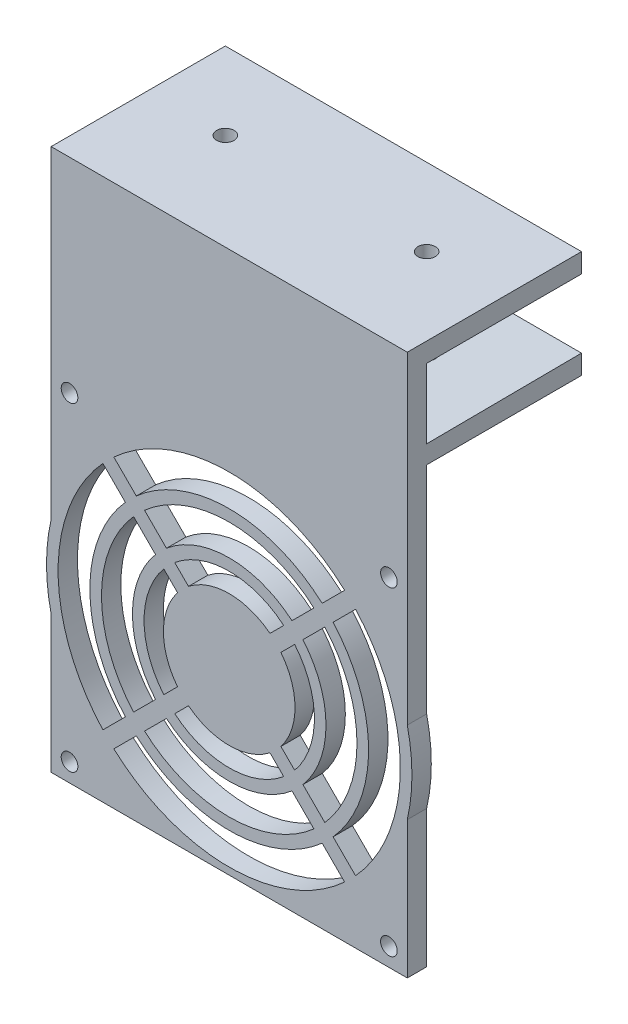
from build123d import *

# Parameters (mm, degrees)
SKETCH1_W            = 92
SKETCH1_H            = 140
BOSS_EXTRUDE1_DEPTH  = 5
SKETCH3_W            = 40
SKETCH3_H            = 5
BOSS_EXTRUDE2_DEPTH  = 92
M4_CLEARANCE_HOLE1_D = 4.5
SKETCH7_R            = 2.15
CUT_EXTRUDE2_DEPTH   = 96.084173236
BOSS_EXTRUDE3_DEPTH  = 5


with BuildPart() as part:
    # Sketch1 → Boss-Extrude1 (new body)
    with BuildSketch(Plane.XY):
        Rectangle(SKETCH1_W, SKETCH1_H)
    extrude(amount=BOSS_EXTRUDE1_DEPTH)

    # Sketch3 → Boss-Extrude2 (add)
    with BuildSketch(Plane(origin=(46, 0, 0), x_dir=(0, 0, -1), z_dir=(1, 0, 0))):
        with Locations((20, 67.5)):
            Rectangle(SKETCH3_W, SKETCH3_H)
        Polygon((0, 47), (40, 47.3), (40, 42.3), (0, 42.3), align=None)
    extrude(amount=-BOSS_EXTRUDE2_DEPTH)

    # M4 Clearance Hole1 (through all)
    with Locations(Plane(origin=(0, 70, 0), x_dir=(1, 0, 0), z_dir=(0, 1, 0))):
        with Locations((-26, 20), (26, 20)):
            Hole(M4_CLEARANCE_HOLE1_D / 2)

    # Sketch7 → Cut-Extrude2 (cut, through all)
    with BuildSketch(Plane.XY.offset(5)):
        with BuildLine():
            ThreePointArc((13.351549949, -13.476877176), (17, -24), (13.351549949, -34.523122824))
            Line((13.351549949, -34.523122824), (16.906146947, -38.077719822))
            ThreePointArc((16.906146947, -38.077719822), (22, -24), (16.906146947, -9.922280178))
            Line((16.906146947, -9.922280178), (13.351549949, -13.476877176))
        make_face()
        with BuildLine():
            Line((-16.906146947, -38.077719822), (-13.351549949, -34.523122824))
            ThreePointArc((-13.351549949, -34.523122824), (-17, -24), (-13.351549949, -13.476877176))
            Line((-13.351549949, -13.476877176), (-16.906146947, -9.922280178))
            ThreePointArc((-16.906146947, -9.922280178), (-22, -24), (-16.906146947, -38.077719822))
        make_face()
        with BuildLine():
            Line((14.077719822, -40.906146947), (10.523122824, -37.351549949))
            ThreePointArc((10.523122824, -37.351549949), (0, -41), (-10.523122824, -37.351549949))
            Line((-10.523122824, -37.351549949), (-14.077719822, -40.906146947))
            ThreePointArc((-14.077719822, -40.906146947), (0, -46), (14.077719822, -40.906146947))
        make_face()
        with BuildLine():
            ThreePointArc((29.80789399, 8.636321115), (0, 20.2), (-29.80789399, 8.636321115))
            Line((-29.80789399, 8.636321115), (-24.002316492, 2.830743617))
            ThreePointArc((-24.002316492, 2.830743617), (0, 12), (24.002316492, 2.830743617))
            Line((24.002316492, 2.830743617), (29.80789399, 8.636321115))
        make_face()
        with BuildLine():
            Line((-26.830743617, 0.002316492), (-32.636321115, 5.80789399))
            ThreePointArc((-32.636321115, 5.80789399), (-44.2, -24), (-32.636321115, -53.80789399))
            Line((-32.636321115, -53.80789399), (-26.830743617, -48.002316492))
            ThreePointArc((-26.830743617, -48.002316492), (-36, -24), (-26.830743617, 0.002316492))
        make_face()
        with BuildLine():
            ThreePointArc((32.636321115, -53.80789399), (44.2, -24), (32.636321115, 5.80789399))
            Line((32.636321115, 5.80789399), (26.830743617, 0.002316492))
            ThreePointArc((26.830743617, 0.002316492), (36, -24), (26.830743617, -48.002316492))
            Line((26.830743617, -48.002316492), (32.636321115, -53.80789399))
        make_face()
        with BuildLine():
            Line((10.523122824, -10.648450051), (14.077719822, -7.093853053))
            ThreePointArc((14.077719822, -7.093853053), (0, -2), (-14.077719822, -7.093853053))
            Line((-14.077719822, -7.093853053), (-10.523122824, -10.648450051))
            ThreePointArc((-10.523122824, -10.648450051), (0, -7), (10.523122824, -10.648450051))
        make_face()
        with BuildLine():
            ThreePointArc((19.035223749, -7.793203376), (25, -24), (19.035223749, -40.206796624))
            Line((19.035223749, -40.206796624), (24.70584296, -45.877415835))
            ThreePointArc((24.70584296, -45.877415835), (33, -24), (24.70584296, -2.122584165))
            Line((24.70584296, -2.122584165), (19.035223749, -7.793203376))
        make_face()
        with BuildLine():
            Line((21.877415835, -48.70584296), (16.206796624, -43.035223749))
            ThreePointArc((16.206796624, -43.035223749), (0, -49), (-16.206796624, -43.035223749))
            Line((-16.206796624, -43.035223749), (-21.877415835, -48.70584296))
            ThreePointArc((-21.877415835, -48.70584296), (0, -57), (21.877415835, -48.70584296))
        make_face()
        with BuildLine():
            Line((-24.70584296, -45.877415835), (-19.035223749, -40.206796624))
            ThreePointArc((-19.035223749, -40.206796624), (-25, -24), (-19.035223749, -7.793203376))
            Line((-19.035223749, -7.793203376), (-24.70584296, -2.122584165))
            ThreePointArc((-24.70584296, -2.122584165), (-33, -24), (-24.70584296, -45.877415835))
        make_face()
        with BuildLine():
            ThreePointArc((21.877415835, 0.70584296), (0, 9), (-21.877415835, 0.70584296))
            Line((-21.877415835, 0.70584296), (-16.206796624, -4.964776251))
            ThreePointArc((-16.206796624, -4.964776251), (0, 1), (16.206796624, -4.964776251))
            Line((16.206796624, -4.964776251), (21.877415835, 0.70584296))
        make_face()
        with BuildLine():
            Line((29.80789399, -56.636321115), (24.002316492, -50.830743617))
            ThreePointArc((24.002316492, -50.830743617), (0, -60), (-24.002316492, -50.830743617))
            Line((-24.002316492, -50.830743617), (-29.80789399, -56.636321115))
            ThreePointArc((-29.80789399, -56.636321115), (0, -68.2), (29.80789399, -56.636321115))
        make_face()
        with Locations((-41.25, 17.25)):
            Circle(SKETCH7_R)
        with Locations((41.25, 17.25)):
            Circle(SKETCH7_R)
        with Locations((41.25, -65.25)):
            Circle(SKETCH7_R)
        with Locations((-41.25, -65.25)):
            Circle(SKETCH7_R)
    extrude(amount=-CUT_EXTRUDE2_DEPTH, mode=Mode.SUBTRACT)

    # Sketch9 → Boss-Extrude3 (add)
    with BuildSketch(Plane.XY.offset(5)):
        with BuildLine():
            Line((46, -13.424556747), (46, -34.575443253))
            ThreePointArc((46, -34.575443253), (47.2, -24), (46, -13.424556747))
        make_face()
        with BuildLine():
            Line((-46, -13.424556747), (-46, -34.575443253))
            ThreePointArc((-46, -34.575443253), (-47.2, -24), (-46, -13.424556747))
        make_face()
    extrude(amount=-BOSS_EXTRUDE3_DEPTH)


solid = part.part
